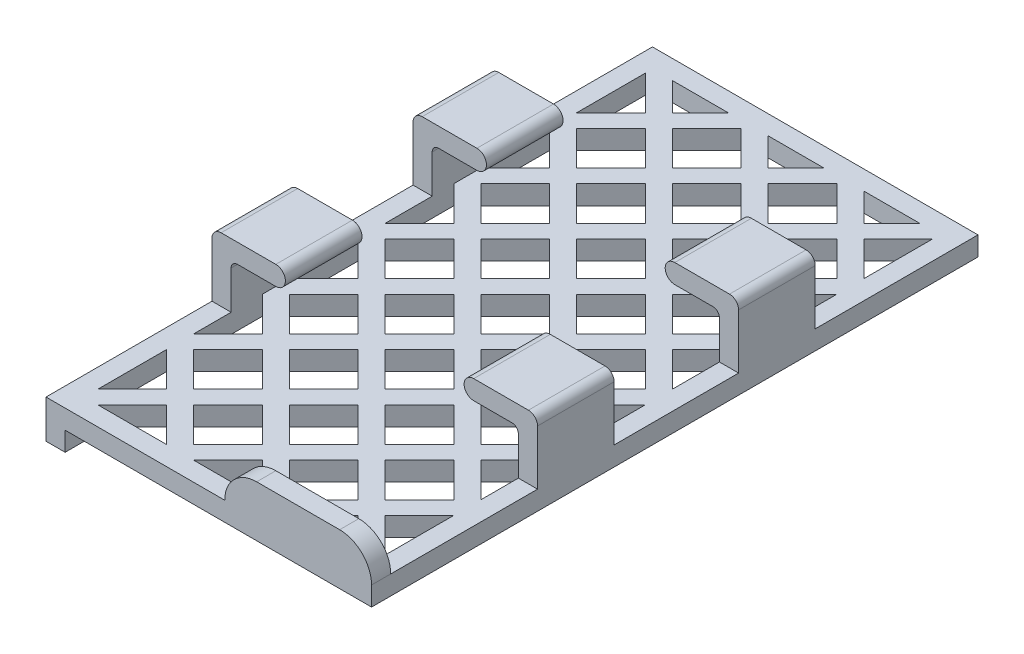
from build123d import *

# Parameters (mm, degrees)
SKETCH3_W            = 51
SKETCH3_H            = 51
SKETCH3_W_2          = 45
SKETCH3_H_2          = 45
EXTRUDE_THIN2_DEPTH  = 3
BOSS_EXTRUDE4_DEPTH  = 7
SKETCH7_W            = 12
SKETCH7_H            = 25
BOSS_EXTRUDE5_DEPTH  = 3
SKETCH8_W            = 3
SKETCH8_H            = 3
BOSS_EXTRUDE6_DEPTH  = 3
SKETCH9_W            = 51
SKETCH9_H            = 3.5
CUT_EXTRUDE1_DEPTH   = 40.452503089
BOSS_EXTRUDE7_DEPTH  = 22
EXTRUDE_THIN3_DEPTH  = 3
EXTRUDE_THIN4_START  = -3
EXTRUDE_THIN4_DEPTH  = 3
SKETCH14_W           = 23
SKETCH14_H           = 3
BOSS_EXTRUDE8_DEPTH  = 5
SKETCH15_W           = 3
SKETCH15_H           = 3
CUT_EXTRUDE2_DEPTH   = 100.218193896
SKETCH16_W           = 19.5
SKETCH16_H           = 10
CUT_EXTRUDE3_DEPTH   = 88.179412707
FILLET1_R            = 1
SKETCH20_W           = 2
SKETCH20_H           = 3
CUT_EXTRUDE4_DEPTH   = 75.701070943
FILLET2_R            = 1.428571429
SKETCH21_R           = 1.5
BOSS_EXTRUDE9_DEPTH  = 12
SKETCH22_R           = 1.5
BOSS_EXTRUDE10_DEPTH = 12
FILLET3_R            = 5
SKETCH23_W           = 3
SKETCH23_H           = 3
BOSS_EXTRUDE11_DEPTH = 3


# Read off the part's stored shape, not the designer's step: Extrude-Thin4
with BuildPart() as part:
    # Sketch3 → Extrude-Thin2 (new body)
    with BuildSketch(Plane(origin=(0, 0, 0), x_dir=(1, 0, 0), z_dir=(0, 1, 0))):
        Rectangle(SKETCH3_W, SKETCH3_H)
        Rectangle(SKETCH3_W_2, SKETCH3_H_2, mode=Mode.SUBTRACT)
    extrude(amount=EXTRUDE_THIN2_DEPTH)

    # Sketch6 → Boss-Extrude4 (add)
    with BuildSketch(Plane(origin=(0, 3, 0), x_dir=(1, 0, 0), z_dir=(0, 1, 0))):
        Polygon((-13.5, 25.5), (-25.5, 25.5), (-25.5, 0.5), (-22.5, 0.5), (-22.5, 22.5), (-13.5, 22.5), align=None)
        Polygon((25.5, 25.5), (13.5, 25.5), (13.5, 22.5), (22.5, 22.5), (22.5, 0.5), (25.5, 0.5), align=None)
    extrude(amount=BOSS_EXTRUDE4_DEPTH)

    # Sketch7 → Boss-Extrude5 (add)
    with BuildSketch(Plane(origin=(0, 10, 0), x_dir=(1, 0, 0), z_dir=(0, 1, 0))):
        with Locations((-19.5, 13)):
            Rectangle(SKETCH7_W, SKETCH7_H)
        with Locations((19.5, 13)):
            Rectangle(SKETCH7_W, SKETCH7_H)
    extrude(amount=BOSS_EXTRUDE5_DEPTH)

    # Sketch8 → Boss-Extrude6 (add)
    with BuildSketch(Plane.XZ):
        with Locations((-24, 24)):
            Rectangle(SKETCH8_W, SKETCH8_H)
    extrude(amount=BOSS_EXTRUDE6_DEPTH)

    # Sketch9 → Cut-Extrude1 (cut, through all)
    with BuildSketch(Plane(origin=(0, 13, 0), x_dir=(1, 0, 0), z_dir=(0, 1, 0))):
        with Locations((0, 23.75)):
            Rectangle(SKETCH9_W, SKETCH9_H)
    extrude(amount=-CUT_EXTRUDE1_DEPTH, mode=Mode.SUBTRACT)

    # Sketch11 → Boss-Extrude7 (add)
    with BuildSketch(Plane(origin=(0, 0, -22), x_dir=(-1, 0, 0), z_dir=(0, 0, -1))):
        Polygon((25.5, 0), (25.5, 13), (13.5, 13), (13.5, 10), (22.5, 10), (22.5, 0), align=None)
        Polygon((-13.5, 13), (-25.5, 13), (-25.5, 0), (-22.5, 0), (-22.5, 10), (-13.5, 10), align=None)
    extrude(amount=BOSS_EXTRUDE7_DEPTH)

    # Sketch10 → Extrude-Thin3 (add)
    with BuildSketch(Plane.XZ):
        Polygon((-25.5, 25.5), (-25.5, -69.5), (25.5, -69.5), (25.5, 25.5), (22.5, 25.5), (22.5, -66.5), (-22.5, -66.5), (-22.5, 25.5), align=None)
    extrude(amount=-EXTRUDE_THIN3_DEPTH)

    # Extrude-Thin4 outline → Extrude-Thin4 (add)
    with BuildSketch(Plane.XZ.offset(EXTRUDE_THIN4_START)):
        Polygon((-22.5, -50.378679656), (-22.5, -54.621320344), (-17.121320344, -60), (-22.5, -65.378679656), (-22.5, -66.5), (-19.378679656, -66.5), (-15, -62.121320344), (-10.621320344, -66.5), (-4.378679656, -66.5), (0, -62.121320344), (4.378679656, -66.5), (10.621320344, -66.5), (15, -62.121320344), (19.378679656, -66.5), (22.5, -66.5), (22.5, -65.378679656), (17.121320344, -60), (22.5, -54.621320344), (22.5, -50.378679656), (17.121320344, -45), (22.5, -39.621320344), (22.5, -35.378679656), (17.121320344, -30), (22.5, -24.621320344), (22.5, -20.378679656), (17.121320344, -15), (22.5, -9.621320344), (22.5, -5.378679656), (17.121320344, 0), (22.5, 5.378679656), (22.5, 9.621320344), (17.121320344, 15), (22.5, 20.378679656), (22.5, 22.5), (20.378679656, 22.5), (15, 17.121320344), (9.621320344, 22.5), (5.378679656, 22.5), (0, 17.121320344), (-5.378679656, 22.5), (-9.621320344, 22.5), (-15, 17.121320344), (-20.378679656, 22.5), (-22.5, 22.5), (-22.5, 20.378679656), (-17.121320344, 15), (-22.5, 9.621320344), (-22.5, 5.378679656), (-17.121320344, 0), (-22.5, -5.378679656), (-22.5, -9.621320344), (-17.121320344, -15), (-22.5, -20.378679656), (-22.5, -24.621320344), (-17.121320344, -30), (-22.5, -35.378679656), (-22.5, -39.621320344), (-17.121320344, -45), align=None)
        Polygon((-15, -57.878679656), (-20.378679656, -52.5), (-15, -47.121320344), (-9.621320344, -52.5), align=None, mode=Mode.SUBTRACT)
        Polygon((-7.5, -65.378679656), (-12.878679656, -60), (-7.5, -54.621320344), (-2.121320344, -60), align=None, mode=Mode.SUBTRACT)
        Polygon((-7.5, -50.378679656), (-12.878679656, -45), (-7.5, -39.621320344), (-2.121320344, -45), align=None, mode=Mode.SUBTRACT)
        Polygon((-15, -42.878679656), (-20.378679656, -37.5), (-15, -32.121320344), (-9.621320344, -37.5), align=None, mode=Mode.SUBTRACT)
        Polygon((-20.378679656, -22.5), (-15, -17.121320344), (-9.621320344, -22.5), (-15, -27.878679656), align=None, mode=Mode.SUBTRACT)
        Polygon((-12.878679656, -30), (-7.5, -24.621320344), (-2.121320344, -30), (-7.5, -35.378679656), align=None, mode=Mode.SUBTRACT)
        Polygon((7.5, -65.378679656), (2.121320344, -60), (7.5, -54.621320344), (12.878679656, -60), align=None, mode=Mode.SUBTRACT)
        Polygon((0, -57.878679656), (-5.378679656, -52.5), (0, -47.121320344), (5.378679656, -52.5), align=None, mode=Mode.SUBTRACT)
        Polygon((2.121320344, -45), (7.5, -39.621320344), (12.878679656, -45), (7.5, -50.378679656), align=None, mode=Mode.SUBTRACT)
        Polygon((9.621320344, -52.5), (15, -47.121320344), (20.378679656, -52.5), (15, -57.878679656), align=None, mode=Mode.SUBTRACT)
        Polygon((-5.378679656, -37.5), (0, -32.121320344), (5.378679656, -37.5), (0, -42.878679656), align=None, mode=Mode.SUBTRACT)
        Polygon((-5.378679656, -22.5), (0, -17.121320344), (5.378679656, -22.5), (0, -27.878679656), align=None, mode=Mode.SUBTRACT)
        Polygon((2.121320344, -30), (7.5, -24.621320344), (12.878679656, -30), (7.5, -35.378679656), align=None, mode=Mode.SUBTRACT)
        Polygon((9.621320344, -37.5), (15, -32.121320344), (20.378679656, -37.5), (15, -42.878679656), align=None, mode=Mode.SUBTRACT)
        Polygon((15, -27.878679656), (9.621320344, -22.5), (15, -17.121320344), (20.378679656, -22.5), align=None, mode=Mode.SUBTRACT)
        Polygon((-20.378679656, -7.5), (-15, -2.121320344), (-9.621320344, -7.5), (-15, -12.878679656), align=None, mode=Mode.SUBTRACT)
        Polygon((-12.878679656, -15), (-7.5, -9.621320344), (-2.121320344, -15), (-7.5, -20.378679656), align=None, mode=Mode.SUBTRACT)
        Polygon((-7.5, -5.378679656), (-12.878679656, 0), (-7.5, 5.378679656), (-2.121320344, 0), align=None, mode=Mode.SUBTRACT)
        Polygon((-15, 2.121320344), (-20.378679656, 7.5), (-15, 12.878679656), (-9.621320344, 7.5), align=None, mode=Mode.SUBTRACT)
        Polygon((-12.878679656, 15), (-7.5, 20.378679656), (-2.121320344, 15), (-7.5, 9.621320344), align=None, mode=Mode.SUBTRACT)
        Polygon((7.5, -20.378679656), (2.121320344, -15), (7.5, -9.621320344), (12.878679656, -15), align=None, mode=Mode.SUBTRACT)
        Polygon((0, -12.878679656), (-5.378679656, -7.5), (0, -2.121320344), (5.378679656, -7.5), align=None, mode=Mode.SUBTRACT)
        Polygon((2.121320344, 0), (7.5, 5.378679656), (12.878679656, 0), (7.5, -5.378679656), align=None, mode=Mode.SUBTRACT)
        Polygon((9.621320344, -7.5), (15, -2.121320344), (20.378679656, -7.5), (15, -12.878679656), align=None, mode=Mode.SUBTRACT)
        Polygon((-5.378679656, 7.5), (0, 12.878679656), (5.378679656, 7.5), (0, 2.121320344), align=None, mode=Mode.SUBTRACT)
        Polygon((2.121320344, 15), (7.5, 20.378679656), (12.878679656, 15), (7.5, 9.621320344), align=None, mode=Mode.SUBTRACT)
        Polygon((9.621320344, 7.5), (15, 12.878679656), (20.378679656, 7.5), (15, 2.121320344), align=None, mode=Mode.SUBTRACT)
    extrude(amount=EXTRUDE_THIN4_DEPTH)

    # Sketch14 → Boss-Extrude8 (add)
    with BuildSketch(Plane(origin=(0, 3, 0), x_dir=(1, 0, 0), z_dir=(0, 1, 0))):
        with Locations((14, -24)):
            Rectangle(SKETCH14_W, SKETCH14_H)
    extrude(amount=BOSS_EXTRUDE8_DEPTH)

    # Sketch15 → Cut-Extrude2 (cut, through all)
    with BuildSketch(Plane.XY.offset(25.5)):
        with Locations((-24, -1.5)):
            Rectangle(SKETCH15_W, SKETCH15_H)
    extrude(amount=-CUT_EXTRUDE2_DEPTH, mode=Mode.SUBTRACT)

    # Sketch16 → Cut-Extrude3 (cut, through all)
    with BuildSketch(Plane(origin=(25.5, 0, 0), x_dir=(0, 0, -1), z_dir=(1, 0, 0))):
        with Locations((22.25, 8)):
            Rectangle(SKETCH16_W, SKETCH16_H)
    extrude(amount=-CUT_EXTRUDE3_DEPTH, mode=Mode.SUBTRACT)

    # Fillet1
    fillet1_edges = [part.edges().sort_by_distance(p)[0] for p in [
        (22.5, 10, -6.5),
        (-22.5, 10, -38),
        (-22.5, 10, -6.5),
        (22.5, 10, -38),
    ]]
    fillet(fillet1_edges, radius=FILLET1_R)

    # Sketch20 → Cut-Extrude4 (cut, through all)
    with BuildSketch(Plane.XY.offset(-0.5)):
        with Locations((-14.5, 11.5)):
            Rectangle(SKETCH20_W, SKETCH20_H)
        with Locations((14.5, 11.5)):
            Rectangle(SKETCH20_W, SKETCH20_H)
    extrude(amount=-CUT_EXTRUDE4_DEPTH, mode=Mode.SUBTRACT)

    # Fillet2
    fillet2_edges = [part.edges().sort_by_distance(p)[0] for p in [
        (25.5, 13, -38),
        (-25.5, 13, -6.5),
        (-25.5, 13, -38),
        (25.5, 13, -6.5),
    ]]
    fillet(fillet2_edges, radius=FILLET2_R)

    # Sketch21 → Boss-Extrude9 (add)
    with BuildSketch(Plane.XY.offset(-0.5)):
        with Locations((-15.5, 11.5)):
            Circle(SKETCH21_R)
        with Locations((15.5, 11.5)):
            Circle(SKETCH21_R)
    extrude(amount=-BOSS_EXTRUDE9_DEPTH)

    # Sketch22 → Boss-Extrude10 (add)
    with BuildSketch(Plane.XY.offset(-32)):
        with Locations((-15.5, 11.5)):
            Circle(SKETCH22_R)
        with Locations((15.5, 11.5)):
            Circle(SKETCH22_R)
    extrude(amount=-BOSS_EXTRUDE10_DEPTH)

    # Fillet3
    fillet3_edges = [part.edges().sort_by_distance(p)[0] for p in [
        (25.5, 8, 24),
        (2.5, 8, 24),
    ]]
    fillet(fillet3_edges, radius=FILLET3_R - 0.0001)  # a hair under: the kernel refuses the full size

    # Sketch23 → Boss-Extrude11 (add)
    with BuildSketch(Plane.XZ):
        with Locations((-24, 24)):
            Rectangle(SKETCH23_W, SKETCH23_H)
    extrude(amount=BOSS_EXTRUDE11_DEPTH)


solid = part.part
